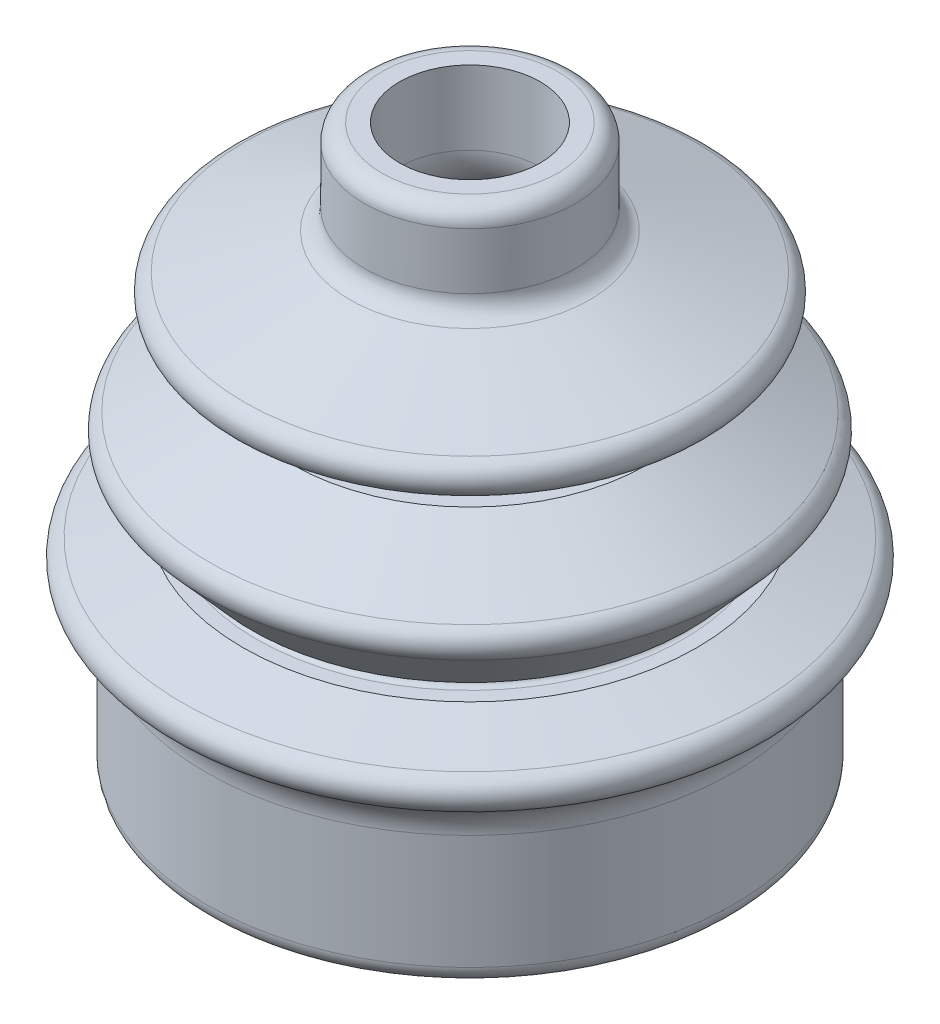
from build123d import *

# Parameters (mm, degrees)
CUT_EXTRUDE6_DEPTH = 25.4
FILLET2_R          = 2.54


# Read off the part's stored shape, not the designer's step: Shell5
with BuildPart() as part:
    # Sketch1 → Revolve1 (revolve)
    with BuildSketch(Plane.XY, mode=Mode.PRIVATE) as revolve1_sk:
        with BuildLine():
            Line((0, 0), (0, 81.28))
            Line((0, 81.28), (15.24, 81.28))
            Line((15.24, 81.28), (15.24, 70.617782167))
            ThreePointArc((15.24, 70.617782167), (15.809468766, 68.843750905), (17.305083281, 67.732616882))
            Line((17.305083281, 67.732616882), (32.545083281, 62.540661026))
            ThreePointArc((32.545083281, 62.540661026), (34.252497966, 60.397770779), (33.02, 57.950692464))
            Line((33.02, 57.950692464), (24.384, 52.837782167))
            Line((24.384, 52.837782167), (23.622, 52.837782167))
            ThreePointArc((23.622, 52.837782167), (22.86, 52.075782167), (23.622, 51.313782167))
            Line((23.622, 51.313782167), (25.654, 51.313782167))
            Line((25.654, 51.313782167), (37.592, 45.049511558))
            ThreePointArc((37.592, 45.049511558), (38.911226743, 43.252486551), (38.305142163, 41.107184811))
            Line((38.305142163, 41.107184811), (31.532463786, 33.533782167))
            Line((31.532463786, 33.533782167), (30.770463786, 33.533782167))
            ThreePointArc((30.770463786, 33.533782167), (30.008463786, 32.771782167), (30.770463786, 32.009782167))
            Line((30.770463786, 32.009782167), (32.802463786, 32.009782167))
            Line((32.802463786, 32.009782167), (41.438463786, 29.374963403))
            ThreePointArc((41.438463786, 29.374963403), (43.232600234, 27.099096753), (41.726292283, 24.623307796))
            ThreePointArc((41.726292283, 24.623307796), (39.086374072, 22.374596047), (38.1, 19.05))
            Line((38.1, 19.05), (38.1, 0))
            Line((38.1, 0), (0, 0))
        make_face()
    revolve(revolve1_sk.sketch.rotate(Axis((0, 0, 0), (0, 1, 0)), 90), axis=Axis((0, 0, 0), (0, 1, 0)))

    # Shell5 outline → Shell5 (revolve, cut)
    with BuildSketch(Plane.XY):
        with BuildLine():
            Line((0, 81.28), (0, 25.4))
            Line((0, 25.4), (34.999235569, 25.4))
            ThreePointArc((34.999235569, 25.4), (35.18387039, 25.659424777), (35.375820896, 25.913484288))
            Line((35.375820896, 25.913484288), (32.044757447, 26.929782167))
            Line((32.044757447, 26.929782167), (30.770463786, 26.929782167))
            ThreePointArc((30.770463786, 26.929782167), (24.995922457, 31.886549747), (29.020442836, 38.345505399))
            Line((29.020442836, 38.345505399), (32.346682487, 42.065001701))
            Line((32.346682487, 42.065001701), (24.402118097, 46.233782167))
            Line((24.402118097, 46.233782167), (23.622, 46.233782167))
            ThreePointArc((23.622, 46.233782167), (17.790536831, 51.725066739), (22.921834268, 57.875672851))
            Line((22.921834268, 57.875672851), (25.684408568, 59.511244248))
            Line((25.684408568, 59.511244248), (15.666888749, 62.924008073))
            ThreePointArc((15.666888749, 62.924008073), (11.678583375, 65.887032134), (10.16, 70.617782167))
            Line((10.16, 70.617782167), (10.16, 81.28))
            Line((10.16, 81.28), (0, 81.28))
        make_face()
    revolve(axis=Axis((0, 0, 0), (0, 1, 0)), mode=Mode.SUBTRACT)

    # Sketch4 → Cut-Extrude6 (cut)
    with BuildSketch(Plane.XZ):
        with BuildLine():
            ThreePointArc((-15.826285431, -17.788944827), (-15.766556105, -17.289127555), (-15.746604539, -16.786149592))
            ThreePointArc((-15.746604539, -16.786149592), (-16.078679713, -14.759556194), (-17.040173294, -12.944925429))
            ThreePointArc((-17.040173294, -12.944925429), (-18.532510629, -10.699749999), (-19.730720919, -8.284760242))
            ThreePointArc((-19.730720919, -8.284760242), (-21.169008942, -6.180602458), (-23.318820842, -4.811492816))
            ThreePointArc((-23.318820842, -4.811492816), (-28.133932609, -1.917417309), (-31.654514046, 2.460536633))
            ThreePointArc((-31.654514046, 2.460536633), (-27.496306571, 15.874999999), (-17.958144256, 26.18334499))
            ThreePointArc((-17.958144256, 26.18334499), (-12.406434208, 25.323409001), (-7.492535415, 22.600437643))
            ThreePointArc((-7.492535415, 22.600437643), (-5.231945734, 21.423200745), (-2.690547628, 21.229685672))
            ThreePointArc((-2.690547628, 21.229685672), (-2e-09, 21.3995), (2.690547624, 21.229685672))
            ThreePointArc((2.690547624, 21.229685672), (5.23194573, 21.423200746), (7.492535411, 22.600437644))
            ThreePointArc((7.492535411, 22.600437644), (12.406434204, 25.323409003), (17.958144252, 26.183344993))
            ThreePointArc((17.958144252, 26.183344993), (27.496306569, 15.875000003), (31.654514046, 2.460536637))
            ThreePointArc((31.654514046, 2.460536637), (28.13393261, -1.917417305), (23.318820843, -4.811492812))
            ThreePointArc((23.318820843, -4.811492812), (21.169008943, -6.180602455), (19.73072092, -8.284760239))
            ThreePointArc((19.73072092, -8.284760239), (18.532510628, -10.69975), (17.040173292, -12.944925432))
            ThreePointArc((17.040173292, -12.944925432), (15.937063208, -15.24259829), (15.826285427, -17.78894483))
            ThreePointArc((15.826285427, -17.78894483), (15.977042244, -19.050483621), (16.027399998, -20.32))
            ThreePointArc((16.027399998, -20.32), (15.43364422, -24.642057009), (13.696369788, -28.643881626))
            ThreePointArc((13.696369788, -28.643881626), (-3e-09, -31.75), (-13.696369794, -28.643881624))
            ThreePointArc((-13.696369794, -28.643881624), (-15.727498405, -23.405991693), (-15.826285431, -17.788944827))
        make_face()
    extrude(amount=-CUT_EXTRUDE6_DEPTH, mode=Mode.SUBTRACT)

    # Fillet2
    fillet2_edges = [part.edges().sort_by_distance(p)[0] for p in [
        (0, 0, 38.1),
        (0, 81.28, 15.24),
    ]]
    fillet(fillet2_edges, radius=FILLET2_R)


solid = part.part
